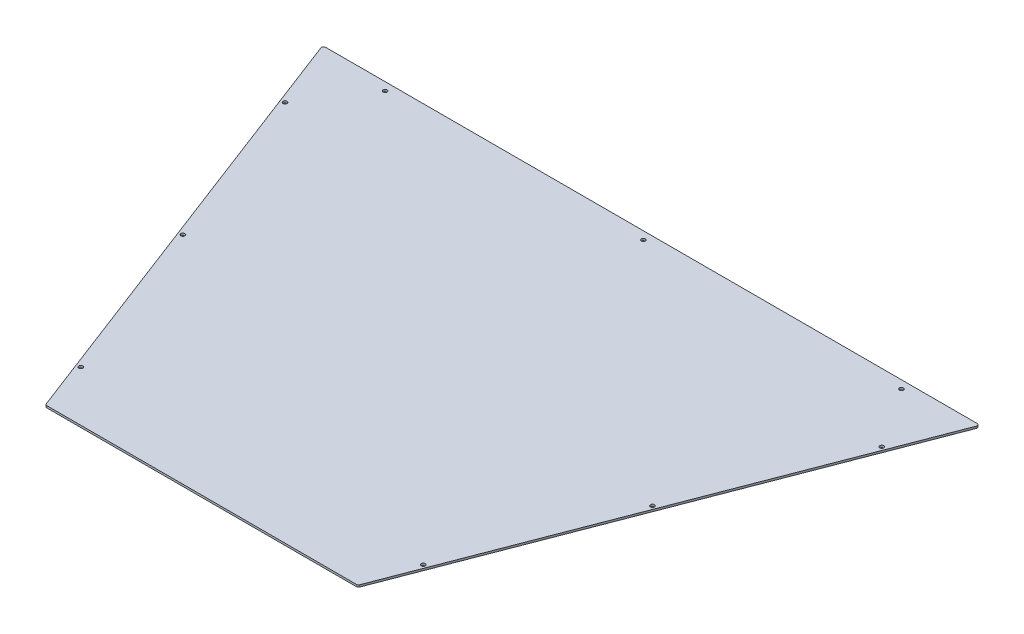
from build123d import *

# Parameters (mm, degrees)
BOSS_EXTRUDE1_DEPTH         = 3.175
FILLET1_R                   = 3.175
F_1_4_0_25_DIAMETER_HOLE1_D = 6.35


with BuildPart() as part:
    # Sketch1 → Boss-Extrude1 (new body)
    with BuildSketch(Plane(origin=(0, 0, 0), x_dir=(1, 0, 0), z_dir=(0, 1, 0))):
        Polygon((-245.911961207, 0), (245.911961207, 0), (517.525, 708.025), (-517.525, 708.025), align=None)
    extrude(amount=BOSS_EXTRUDE1_DEPTH)

    # Fillet1
    fillet1_edges = [part.edges().sort_by_distance(p)[0] for p in [
        (517.525, 1.5875, -708.025),
        (-517.525, 1.5875, -708.025),
        (-245.911961207, 1.5875, 0),
        (245.911961207, 1.5875, 0),
    ]]
    fillet(fillet1_edges, radius=FILLET1_R)

    # 1/4 (0.25) Diameter Hole1 (through all)
    with Locations(Plane(origin=(0, 3.175, 0), x_dir=(1, 0, 0), z_dir=(0, 1, 0))):
        with Locations((-406.4, 695.325), (0, 695.325), (406.4, 695.325), (-469.681706805, 601.038913991), (-369.60903133, 340.175310506), (-269.536355855, 79.311707021), (269.536355855, 79.311707021), (369.60903133, 340.175310506), (469.681706805, 601.038913991)):
            Hole(F_1_4_0_25_DIAMETER_HOLE1_D / 2)


solid = part.part
